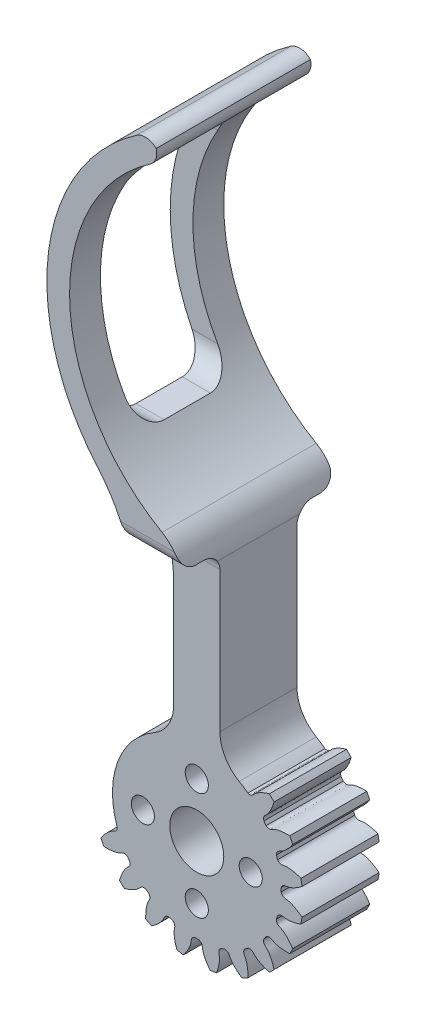
from build123d import *
from build123d.topology import SkipClean

# Parameters (mm, degrees)
SKETCH_1_R               = 13.75
EXTRUDE_1_DEPTH          = 10
CUT_EXTRUDE_1_DEPTH      = 22.866069606
PATTERN_CIRCULAR_1_COUNT = 20
EXTRUDE_2_DEPTH          = 5
EXTRUDE_2_DEPTH_BACK     = 15
CUT_EXTRUDE_3_DEPTH      = 10
CUT_EXTRUDE_3_DEPTH_BACK = 32
SKETCH_7_W               = 5
SKETCH_7_H               = 34
FILLET_2_R               = 2
SKETCH_4_R               = 3.5
SKETCH_4_R_2             = 1.5
CUT_EXTRUDE_2_DEPTH      = 20
CUT_EXTRUDE_START        = -10
CUT_EXTRUDE_5_DEPTH      = 10
FILLET_3_R               = 20
FILLET_4_R               = 5
FILLET_5_R               = 2
SKETCH_19_W              = 12
SKETCH_19_H              = 30
CUT_EXTRUDE_6_DEPTH      = 55
FILLET_6_R               = 3
CUT_EXTRUDE_7_DEPTH      = 10
FILLET_7_R               = 5


with BuildPart() as part:
    # 草图1 → 凸台-拉伸1 (new body)
    with BuildSketch(Plane.XY):
        Circle(SKETCH_1_R)
    extrude(amount=EXTRUDE_1_DEPTH)

    # 草图2 → 切除-拉伸1 (cut, through all)
    with BuildSketch(Plane.XY):
        with BuildLine():
            ThreePointArc((0.241645751, 10.934830295), (0, 10.9375), (-0.241645751, 10.934830295))
            add(Edge.make_bspline(
                [(-0.241645751, 10.934830295), (-0.763986756, 11.11684439), (-0.696355124, 11.483892124), (-0.766121321, 11.837511753), (-0.773615233, 11.871945767), (-0.782888612, 11.910793269), (-0.794115121, 11.953996045), (-0.807473925, 12.001489371), (-0.823140069, 12.053203535), (-0.841287339, 12.109063416), (-0.862087187, 12.168988684), (-0.885708875, 12.232893806), (-0.912319248, 12.300688126), (-0.942082628, 12.372275913), (-0.975160664, 12.447556439), (-1.011712206, 12.526424039), (-1.051893167, 12.608768189), (-1.095856396, 12.694473577), (-1.143751548, 12.783420187), (-1.195724957, 12.87548338), (-1.251919512, 12.970533976), (-1.312474533, 13.068438347), (-1.377525652, 13.169058507), (-1.447204695, 13.272252205), (-1.521639564, 13.377873025), (-1.600954126, 13.485770488), (-1.685268101, 13.595790151), (-1.774696952, 13.707773716), (-1.869351783, 13.821559139), (-1.969339231, 13.936980743), (-2.074761371, 14.053869328), (-2.185715611, 14.172052294), (-2.302294605, 14.291353753), (-2.424586158, 14.411594659), (-2.552673133, 14.532592924), (-2.686633373, 14.654163553), (-2.826539612, 14.776118764), (-2.972459398, 14.898268124), (-3.124455015, 15.020418683), (-3.282583418, 15.142375102), (-3.446896124, 15.2639398), (-3.676841988, 15.427049835), (-3.854915516, 15.545415751), (-3.976447477, 15.622814825)],
                knots=[0, 0, 0, 0, 0.165916003, 0.170905922, 0.176663519, 0.183188797, 0.190481754, 0.198542391, 0.207370708, 0.216966704, 0.22733038, 0.238461736, 0.250360771, 0.263027487, 0.276461881, 0.290663956, 0.30563371, 0.321371144, 0.337876258, 0.355149051, 0.373189524, 0.391997677, 0.411573509, 0.431917021, 0.453028213, 0.474907084, 0.497553636, 0.520967867, 0.545149777, 0.570099367, 0.595816637, 0.622301587, 0.649554216, 0.677574526, 0.706362514, 0.735918183, 0.766241531, 0.797332559, 0.829191267, 0.861817654, 0.895211721, 0.929373468, 1, 1, 1, 1], degree=3))
            ThreePointArc((-3.976447477, 15.622814825), (0, 16.120932901), (3.976447477, 15.622814825))
            add(Edge.make_bspline(
                [(0.241645751, 10.934830295), (0.763986756, 11.11684439), (0.696355124, 11.483892124), (0.766121321, 11.837511753), (0.773615233, 11.871945767), (0.782888612, 11.910793269), (0.794115121, 11.953996045), (0.807473925, 12.001489371), (0.823140069, 12.053203535), (0.841287339, 12.109063416), (0.862087187, 12.168988684), (0.885708875, 12.232893806), (0.912319248, 12.300688126), (0.942082628, 12.372275913), (0.975160664, 12.447556439), (1.011712206, 12.526424039), (1.051893167, 12.608768189), (1.095856396, 12.694473577), (1.143751548, 12.783420187), (1.195724957, 12.87548338), (1.251919512, 12.970533976), (1.312474533, 13.068438347), (1.377525652, 13.169058507), (1.447204695, 13.272252205), (1.521639564, 13.377873025), (1.600954126, 13.485770488), (1.685268101, 13.595790151), (1.774696952, 13.707773716), (1.869351783, 13.821559139), (1.969339231, 13.936980743), (2.074761371, 14.053869328), (2.185715611, 14.172052294), (2.302294605, 14.291353753), (2.424586158, 14.411594659), (2.552673133, 14.532592924), (2.686633373, 14.654163553), (2.826539612, 14.776118764), (2.972459398, 14.898268124), (3.124455015, 15.020418683), (3.282583418, 15.142375102), (3.446896124, 15.2639398), (3.676841988, 15.427049835), (3.854915516, 15.545415751), (3.976447477, 15.622814825)],
                knots=[0, 0, 0, 0, 0.165916003, 0.170905922, 0.176663519, 0.183188797, 0.190481754, 0.198542391, 0.207370708, 0.216966704, 0.22733038, 0.238461736, 0.250360771, 0.263027487, 0.276461881, 0.290663956, 0.30563371, 0.321371144, 0.337876258, 0.355149051, 0.373189524, 0.391997677, 0.411573509, 0.431917021, 0.453028213, 0.474907084, 0.497553636, 0.520967867, 0.545149777, 0.570099367, 0.595816637, 0.622301587, 0.649554216, 0.677574526, 0.706362514, 0.735918183, 0.766241531, 0.797332559, 0.829191267, 0.861817654, 0.895211721, 0.929373468, 1, 1, 1, 1], degree=3))
        make_face()
    cut_extrude_1 = extrude(amount=CUT_EXTRUDE_1_DEPTH, mode=Mode.SUBTRACT)

    # 阵列(圆周)1: 切除-拉伸1 ×20 about axis
    pattern_circular_1_axis = Axis((0, 0, -1.5), (0, 0, 1))
    for i in range(1, PATTERN_CIRCULAR_1_COUNT):
        add(cut_extrude_1.rotate(pattern_circular_1_axis, i * 360 / PATTERN_CIRCULAR_1_COUNT), mode=Mode.SUBTRACT)

    # 草图6 → 凸台-拉伸2 (add, two sides: drawn at the far end of the back side and taken through both)
    with BuildSketch(Plane(origin=(0, 0, 0), x_dir=(-1, 0, 0), z_dir=(0, 0, -1)).offset(-EXTRUDE_2_DEPTH_BACK)):
        with BuildLine():
            Line((-3, 0), (3, 0))
            Line((3, 0), (3, 10.408762688))
            Line((3, 10.408762688), (3, 14.089280207))
            Line((3, 14.089280207), (3, 36.180263159))
            ThreePointArc((3, 36.180263159), (14.417519982, 59.422962185), (0.972193585, 81.554523779))
            Line((0.972193585, 81.554523779), (-0.5, 79.004609691))
            ThreePointArc((-0.5, 79.004609691), (11.459208333, 56.821309169), (-3, 36.180263159))
            Line((-3, 36.180263159), (-3, 14.089280207))
            Line((-3, 14.089280207), (-3, 10.408762688))
            Line((-3, 10.408762688), (-3, 0))
        make_face()
        with BuildLine():
            Line((3, 14.089280207), (3, 10.408762688))
            add(Edge.make_bspline(
                [(3, 10.408762688), (4.143981006, 10.127323028), (4.164071496, 10.622556898), (4.393103935, 11.03302397), (4.418885843, 11.076011904), (4.458931571, 11.138710403), (4.509766902, 11.213065778), (4.58267603, 11.311112911), (4.671237054, 11.420807284), (4.776478734, 11.5410308), (4.899365137, 11.670602183), (5.040791529, 11.808280759), (5.201581362, 11.952770029), (5.38248323, 12.10272148), (5.584168076, 12.256738531), (5.744241751, 12.369149234), (5.836552423, 12.430773747), (5.853360338, 12.441891848)],
                knots=[0.445371732, 0.445371732, 0.445371732, 0.445371732, 0.658484305, 0.663474224, 0.675757099, 0.683050056, 0.69993901, 0.719898682, 0.742929074, 0.769030183, 0.798202012, 0.83044456, 0.865757826, 0.904141811, 0.945596515, 0.990121938, 1, 1, 1, 1], degree=3))
            Line((5.853360338, 12.441891848), (3, 14.089280207))
        make_face()
        with BuildLine():
            add(Edge.make_bspline(
                [(-3, 10.408762688), (-4.143981006, 10.127323028), (-4.164071496, 10.622556898), (-4.393103935, 11.03302397), (-4.418885843, 11.076011904), (-4.458931571, 11.138710403), (-4.509766902, 11.213065778), (-4.58267603, 11.311112911), (-4.671237054, 11.420807284), (-4.776478734, 11.5410308), (-4.899365137, 11.670602183), (-5.040791529, 11.808280759), (-5.201581362, 11.952770029), (-5.38248323, 12.10272148), (-5.584168076, 12.256738531), (-5.744241751, 12.369149234), (-5.836552423, 12.430773747), (-5.853360338, 12.441891848)],
                knots=[-0.04719657, -0.04719657, -0.04719657, -0.04719657, 0.165916003, 0.170905922, 0.183188797, 0.190481754, 0.207370708, 0.22733038, 0.250360771, 0.276461881, 0.30563371, 0.337876258, 0.373189524, 0.411573509, 0.453028213, 0.497553636, 0.507431698, 0.507431698, 0.507431698, 0.507431698], degree=3))
            Line((-3, 10.408762688), (-3, 14.089280207))
            Line((-3, 14.089280207), (-5.853360338, 12.441891848))
        make_face()
    extrude(amount=EXTRUDE_2_DEPTH + EXTRUDE_2_DEPTH_BACK)

    # 草图7 → 切除-拉伸3 (cut, two sides: drawn at the far end of the back side and taken through both)
    with SkipClean():  # the faces are left unmerged after this step: merging them gives an invalid solid
        with BuildSketch(Plane(origin=(3, 0, 0), x_dir=(0, 0, -1), z_dir=(1, 0, 0)).offset(-CUT_EXTRUDE_3_DEPTH_BACK)):
            with Locations((2.5, 17)):
                Rectangle(SKETCH_7_W, SKETCH_7_H)
            with Locations((-12.5, 17)):
                Rectangle(SKETCH_7_W, SKETCH_7_H)
        extrude(amount=CUT_EXTRUDE_3_DEPTH + CUT_EXTRUDE_3_DEPTH_BACK, mode=Mode.SUBTRACT)

    # 圆角2
    fillet_2_edges = [part.edges().sort_by_distance(p)[0] for p in [
        (0, 34, 15),
        (0, 34, -5),
        (0, 34, 0),
        (0, 34, 10),
    ]]
    fillet(fillet_2_edges, radius=FILLET_2_R)

    # 草图4 → 切除-拉伸2 (cut)
    with BuildSketch(Plane.XY.offset(10)):
        Circle(SKETCH_4_R)
        with Locations((0, 7)):
            Circle(SKETCH_4_R_2)
        with Locations((7, 0)):
            Circle(SKETCH_4_R_2)
        with Locations((0, -7)):
            Circle(SKETCH_4_R_2)
        with Locations((-7, 0)):
            Circle(SKETCH_4_R_2)
    extrude(amount=-CUT_EXTRUDE_2_DEPTH, mode=Mode.SUBTRACT)

    # 草图17 → 切除-拉伸5 (cut)
    with BuildSketch(Plane.XY.offset(10).offset(CUT_EXTRUDE_START)):
        with BuildLine():
            ThreePointArc((-10.324968963, -3.608867158), (-10.47431425, 3.149229626), (-6.622827503, 8.704427731))
            Line((-6.622827503, 8.704427731), (-10.596524004, 13.927084369))
            ThreePointArc((-10.596524004, 13.927084369), (-16.7589028, 5.038767402), (-16.519950341, -5.774187452))
            Line((-16.519950341, -5.774187452), (-10.324968963, -3.608867158))
        make_face()
    extrude(amount=CUT_EXTRUDE_5_DEPTH, mode=Mode.SUBTRACT)

    # 圆角3
    fillet_3_edges = [part.edges().sort_by_distance(p)[0] for p in [
        (-3, 36.180263159, 5),
    ]]
    fillet(fillet_3_edges, radius=FILLET_3_R)

    # 圆角4
    fillet_4_edges = [part.edges().sort_by_distance(p)[0] for p in [
        (3, 36.180263159, 5),
    ]]
    fillet(fillet_4_edges, radius=FILLET_4_R)

    # 圆角5
    # the kernel refuses this fillet: 2 mm, written as the material it takes off along each edge
    with BuildSketch(Plane(origin=(-0.972193585, 81.554523779, -10.405244042), x_dir=(-0.8452673458121286, -0.5343436292347085, 0), z_dir=(0, 0, 1))) as fillet_5_piece_1:
        with BuildLine():
            CenterArc((2.081854648, 1.998389618), FILLET_5_R, 177.700591091, 94.598817818)
            Line((0.08346503, 2.078632587), (0, 0))
            ThreePointArc((0, 0), (1.081048808, -0.021695376), (2.162097617, 0))
        make_face()
    extrude(amount=30.810488085, mode=Mode.SUBTRACT)
    with BuildSketch(Plane(origin=(0.5, 79.004609691, 19.807406984), x_dir=(-0.8461386341816294, -0.5329628615065469, 0), z_dir=(0, 0, -1))) as fillet_5_piece_2:
        with BuildLine():
            CenterArc((1.924503012, 1.998517966), FILLET_5_R, 182.205862893, 85.588274214)
            Line((-0.074014954, 1.921537846), (0, 0))
            ThreePointArc((0, 0), (0.923761446, 0.017784406), (1.847522892, 0))
        make_face()
    extrude(amount=29.614813968, mode=Mode.SUBTRACT)

    # 草图19 → 切除-拉伸6 (cut)
    with BuildSketch(Plane(origin=(12.5, 0, 0), x_dir=(0, 0, -1), z_dir=(1, 0, 0))):
        with Locations((-5, 58.22)):
            Rectangle(SKETCH_19_W, SKETCH_19_H)
    extrude(amount=-CUT_EXTRUDE_6_DEPTH, mode=Mode.SUBTRACT)

    # 圆角6
    fillet_6_edges = [part.edges().sort_by_distance(p)[0] for p in [
        (-8.05901164, 73.22, -1),
        (-8.05901164, 43.22, -1),
        (-8.05901164, 43.22, 11),
        (-8.05901164, 73.22, 11),
    ]]
    fillet(fillet_6_edges, radius=FILLET_6_R)

    # 草图20 → 切除-拉伸7 (cut)
    with BuildSketch(Plane(origin=(0, 0, 0), x_dir=(-1, 0, 0), z_dir=(0, 0, -1))):
        with BuildLine():
            Line((-3, 10.518027679), (-3, 14.089280207))
            Line((-3, 14.089280207), (-5.853360338, 12.441891848))
            ThreePointArc((-5.853360338, 12.441891848), (-6.242369371, 12.251339708), (-6.625183064, 12.048628526))
            add(Edge.make_bspline(
                [(-6.231836465, 8.988499348), (-5.916238915, 9.442776183), (-6.1866993, 9.699971162), (-6.343702187, 10.03914452), (-6.36332593, 10.085270195), (-6.390511793, 10.154521122), (-6.420786297, 10.239352761), (-6.457253184, 10.355968144), (-6.493942932, 10.492092252), (-6.529346293, 10.647900169), (-6.561940927, 10.823477506), (-6.590196887, 11.018819297), (-6.61258127, 11.233829666), (-6.627563092, 11.468321604), (-6.633618126, 11.722017023), (-6.630471349, 11.9175927), (-6.626067777, 12.028495582), (-6.625183064, 12.048628526)],
                knots=[0.492568302, 0.492568302, 0.492568302, 0.492568302, 0.658484305, 0.663474224, 0.675757099, 0.683050056, 0.69993901, 0.719898682, 0.742929074, 0.769030183, 0.798202012, 0.83044456, 0.865757826, 0.904141811, 0.945596515, 0.990121938, 1, 1, 1, 1], degree=3))
            ThreePointArc((-6.231836465, 8.988499348), (-4.67884231, 9.886219747), (-3, 10.518027679))
        make_face()
        with BuildLine():
            Line((3, 14.089280207), (3, 10.518027679))
            ThreePointArc((3, 10.518027679), (4.67884231, 9.886219747), (6.231836465, 8.988499348))
            add(Edge.make_bspline(
                [(6.231836465, 8.988499348), (5.916238915, 9.442776183), (6.1866993, 9.699971162), (6.343702187, 10.03914452), (6.36332593, 10.085270195), (6.390511793, 10.154521122), (6.420786297, 10.239352761), (6.457253184, 10.355968144), (6.493942932, 10.492092252), (6.529346293, 10.647900169), (6.561940927, 10.823477506), (6.590196887, 11.018819297), (6.61258127, 11.233829666), (6.627563092, 11.468321604), (6.633618126, 11.722017023), (6.630471349, 11.9175927), (6.626067777, 12.028495582), (6.625183064, 12.048628526)],
                knots=[0, 0, 0, 0, 0.165916003, 0.170905922, 0.183188797, 0.190481754, 0.207370708, 0.22733038, 0.250360771, 0.276461881, 0.30563371, 0.337876258, 0.373189524, 0.411573509, 0.453028213, 0.497553636, 0.507431698, 0.507431698, 0.507431698, 0.507431698], degree=3))
            ThreePointArc((6.625183064, 12.048628526), (6.242369371, 12.251339708), (5.853360338, 12.441891848))
            Line((5.853360338, 12.441891848), (3, 14.089280207))
        make_face()
    extrude(amount=-CUT_EXTRUDE_7_DEPTH, mode=Mode.SUBTRACT)

    # 圆角7
    fillet_7_edges = [part.edges().sort_by_distance(p)[0] for p in [
        (3, 10.518027679, 5),
        (-3, 10.518027679, 5),
    ]]
    fillet(fillet_7_edges, radius=FILLET_7_R)


solid = part.part
